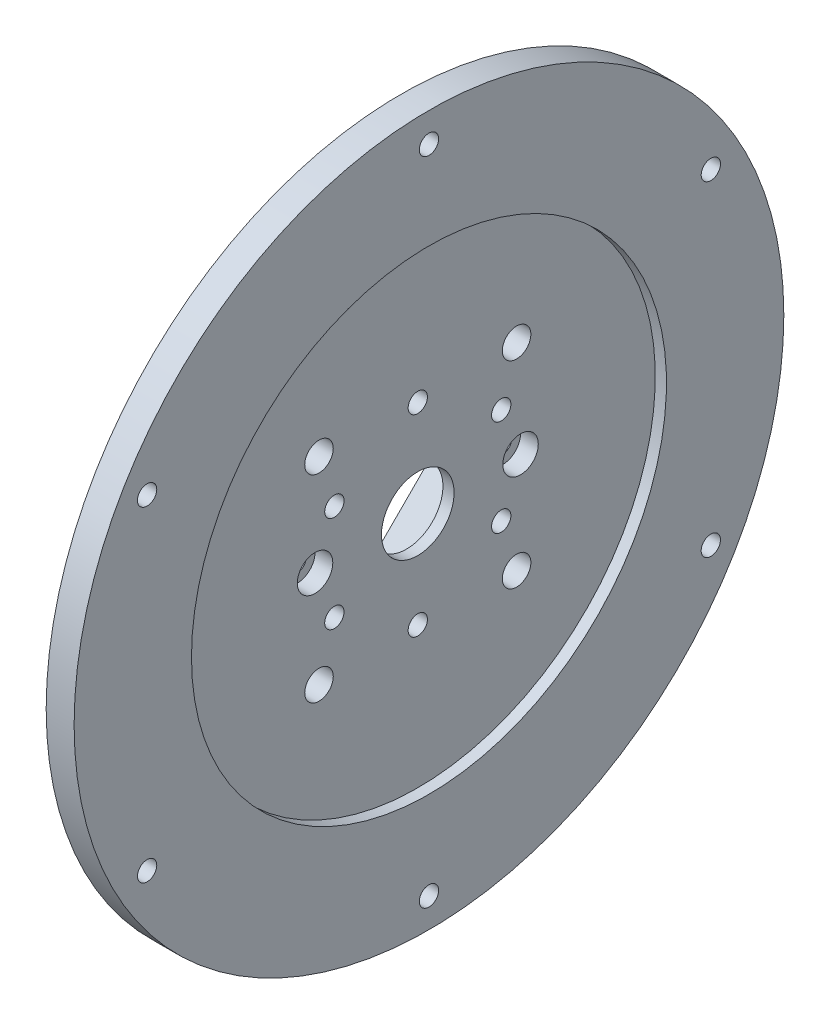
from build123d import *

# Parameters (mm, degrees)
CUT_EXTRUDE1_DEPTH      = 91.850633485
CUT_EXTRUDE1_DEPTH_BACK = 91.850633485
SKETCH4_R               = 1.7272
SKETCH5_R               = 1.5875
CUT_EXTRUDE2_DEPTH      = 92.35314773
SKETCH6_R               = 3.175
CUT_EXTRUDE3_DEPTH      = 3.175
BOSS_EXTRUDE1_REACH     = 93.741
FILLET1_R               = 3.175
SKETCH8_R               = 2.5527
CUT_EXTRUDE4_DEPTH      = 92.741144495


with BuildPart() as part:
    # Sketch2 → Revolve1 (revolve)
    with BuildSketch(Plane.XY):
        Polygon((-2.54e-07, 29.999999944), (-1.80000021, 29.999999944), (-11.760000102, 29.999999944), (-13.760000166, 29.999999944), (-13.760000166, 25.4), (-2.000000064, 25.4), (-2.000000064, 11.499999987), (1.000000032, 11.499999987), (1.000000032, 6.499999954), (2.999999842, 6.499999954), (2.999999842, 42.499999963), (4.999999652, 42.499999963), (4.999999652, 63.5), (-2.54e-07, 63.5), align=None)
    revolve(axis=Axis((0, 0, 0), (1, 0, 0)))

    # Sketch4 → Cut-Extrude1 (cut, two sides: drawn at the far end of the back side and taken through both)
    with BuildSketch(Plane(origin=(0, 0, 0), x_dir=(0, 0, -1), z_dir=(1, 0, 0)).offset(-CUT_EXTRUDE1_DEPTH_BACK)):
        with Locations((0, 58.238499982)):
            Circle(SKETCH4_R)
        with Locations((50.436020463, 29.119249991)):
            Circle(SKETCH4_R)
        with Locations((50.436020463, -29.119249991)):
            Circle(SKETCH4_R)
        with Locations((0, -58.238499982)):
            Circle(SKETCH4_R)
        with Locations((-50.436020463, -29.119249991)):
            Circle(SKETCH4_R)
        with Locations((-50.436020463, 29.119249991)):
            Circle(SKETCH4_R)
        with Locations((-14.928978871, 8.61924997)):
            Circle(SKETCH4_R)
        with Locations((0, 17.23849994)):
            Circle(SKETCH4_R)
        with Locations((14.928978871, 8.61924997)):
            Circle(SKETCH4_R)
        with Locations((14.928978871, -8.61924997)):
            Circle(SKETCH4_R)
        with Locations((0, -17.23849994)):
            Circle(SKETCH4_R)
        with Locations((-14.928978871, -8.61924997)):
            Circle(SKETCH4_R)
    extrude(amount=CUT_EXTRUDE1_DEPTH + CUT_EXTRUDE1_DEPTH_BACK, mode=Mode.SUBTRACT)

    # Sketch5 → Cut-Extrude2 (cut, through all)
    with BuildSketch(Plane(origin=(2.999999842, 0, 0), x_dir=(0, 0, -1), z_dir=(1, 0, 0))):
        with Locations((-18.385, 0)):
            Circle(SKETCH5_R)
        with Locations((18.385, 0)):
            Circle(SKETCH5_R)
    extrude(amount=-CUT_EXTRUDE2_DEPTH, mode=Mode.SUBTRACT)

    # Sketch6 → Cut-Extrude3 (cut)
    with BuildSketch(Plane(origin=(2.999999842, 0, 0), x_dir=(0, 0, -1), z_dir=(1, 0, 0))):
        with Locations((-18.385, 0)):
            Circle(SKETCH6_R)
        with Locations((18.385, 0)):
            Circle(SKETCH6_R)
    extrude(amount=-CUT_EXTRUDE3_DEPTH, mode=Mode.SUBTRACT)

    # Sketch7 → Boss-Extrude1 (add, up to next)
    with BuildSketch(Plane.ZY.offset(13.760000166), mode=Mode.PRIVATE) as boss_extrude1_sk1:
        with BuildLine():
            ThreePointArc((25.213720876, 3.070550371), (17.960512242, 17.960512242), (3.070550371, 25.213720876))
            Line((3.070550371, 25.213720876), (25.213720876, 3.070550371))
        make_face()
    boss_extrude1_tool1 = extrude(boss_extrude1_sk1.sketch, amount=-BOSS_EXTRUDE1_REACH, mode=Mode.PRIVATE) - part.part
    # Sketch7 → Boss-Extrude1 (add, up to next)
    with BuildSketch(Plane.ZY.offset(13.760000166), mode=Mode.PRIVATE) as boss_extrude1_sk2:
        with BuildLine():
            Line((-25.213720876, 3.070550371), (-3.070550371, 25.213720876))
            ThreePointArc((-3.070550371, 25.213720876), (-17.960512242, 17.960512242), (-25.213720876, 3.070550371))
        make_face()
    boss_extrude1_tool2 = extrude(boss_extrude1_sk2.sketch, amount=-BOSS_EXTRUDE1_REACH, mode=Mode.PRIVATE) - part.part
    # Sketch7 → Boss-Extrude1 (add, up to next)
    with BuildSketch(Plane.ZY.offset(13.760000166), mode=Mode.PRIVATE) as boss_extrude1_sk3:
        with BuildLine():
            ThreePointArc((3.070550371, -25.213720876), (17.960512242, -17.960512242), (25.213720876, -3.070550371))
            Line((25.213720876, -3.070550371), (3.070550371, -25.213720876))
        make_face()
    boss_extrude1_tool3 = extrude(boss_extrude1_sk3.sketch, amount=-BOSS_EXTRUDE1_REACH, mode=Mode.PRIVATE) - part.part
    # Sketch7 → Boss-Extrude1 (add, up to next)
    with BuildSketch(Plane.ZY.offset(13.760000166), mode=Mode.PRIVATE) as boss_extrude1_sk4:
        with BuildLine():
            Line((-3.070550371, -25.213720876), (-25.213720876, -3.070550371))
            ThreePointArc((-25.213720876, -3.070550371), (-17.960512242, -17.960512242), (-3.070550371, -25.213720876))
        make_face()
    boss_extrude1_tool4 = extrude(boss_extrude1_sk4.sketch, amount=-BOSS_EXTRUDE1_REACH, mode=Mode.PRIVATE) - part.part
    add(boss_extrude1_tool1.solids().sort_by_distance((-13.76, 15.684318, 15.684318))[0])
    add(boss_extrude1_tool2.solids().sort_by_distance((-13.76, 15.684318, -15.684318))[0])
    add(boss_extrude1_tool3.solids().sort_by_distance((-13.76, -15.684318, 15.684318))[0])
    add(boss_extrude1_tool4.solids().sort_by_distance((-13.76, -15.684318, -15.684318))[0])

    # Fillet1
    fillet1_edges = [part.edges().sort_by_distance(p)[0] for p in [
        (-7.880000115, -25.213720876, -3.070550371),
        (-7.880000115, -25.213720876, 3.070550371),
        (-7.880000115, -3.070550371, 25.213720876),
        (-7.880000115, 3.070550371, 25.213720876),
        (-7.880000115, -3.070550371, -25.213720876),
        (-7.880000115, 3.070550371, -25.213720876),
        (-7.880000115, 25.213720876, 3.070550371),
        (-7.880000115, 25.213720876, -3.070550371),
    ]]
    fillet(fillet1_edges, radius=FILLET1_R)

    # Sketch8 → Cut-Extrude4 (cut, through all)
    with BuildSketch(Plane.ZY.offset(13.760000166)):
        with Locations((17.67766951, 17.67766951)):
            Circle(SKETCH8_R)
        with Locations((17.67766951, -17.67766951)):
            Circle(SKETCH8_R)
        with Locations((-17.67766951, -17.67766951)):
            Circle(SKETCH8_R)
        with Locations((-17.67766951, 17.67766951)):
            Circle(SKETCH8_R)
    extrude(amount=-CUT_EXTRUDE4_DEPTH, mode=Mode.SUBTRACT)


solid = part.part
